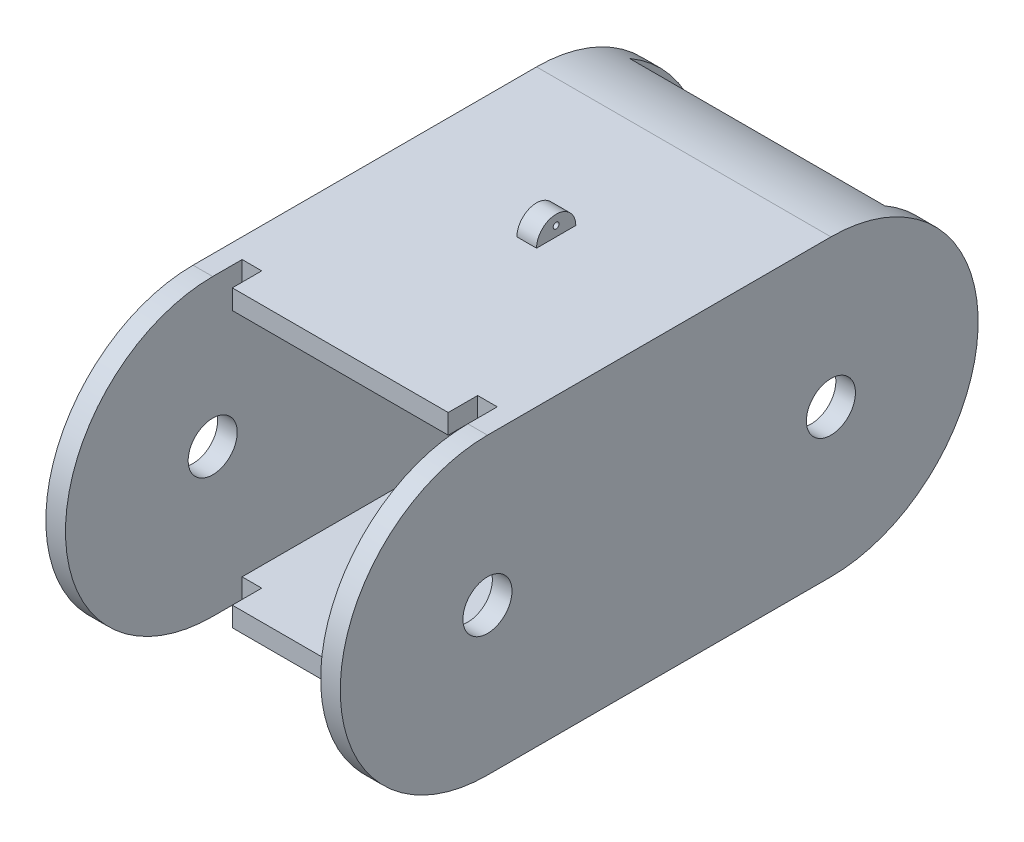
from build123d import *

# Parameters (mm, degrees)
SKETCH1_W           = 19.05
SKETCH1_H           = 41.275
BOSS_EXTRUDE1_DEPTH = 19.05
SKETCH2_W           = 16.51
SKETCH2_H           = 16.51
CUT_EXTRUDE1_DEPTH  = 50.8
SKETCH3_W           = 1.27
SKETCH3_H           = 2.54
BOSS_EXTRUDE2_DEPTH = 1.27
SKETCH4_R           = 0.1905
SKETCH4_R_2         = 1.5875
CUT_EXTRUDE2_DEPTH  = 19.05
CUT_EXTRUDE3_DEPTH  = 25.4


with BuildPart() as part:
    # Sketch1 → Boss-Extrude1 (new body)
    with BuildSketch(Plane(origin=(0, 0, 0), x_dir=(1, 0, 0), z_dir=(0, 1, 0))):
        with Locations((9.525, 20.6375)):
            Rectangle(SKETCH1_W, SKETCH1_H)
    extrude(amount=BOSS_EXTRUDE1_DEPTH)

    # Sketch2 → Cut-Extrude1 (cut)
    with BuildSketch(Plane.XY):
        with Locations((9.525, 9.525)):
            Rectangle(SKETCH2_W, SKETCH2_H)
    extrude(amount=-CUT_EXTRUDE1_DEPTH, mode=Mode.SUBTRACT)

    # Sketch3 → Boss-Extrude2 (add)
    with BuildSketch(Plane(origin=(0, 19.05, 0), x_dir=(1, 0, 0), z_dir=(0, 1, 0))):
        with Locations((9.525, 22.86)):
            Rectangle(SKETCH3_W, SKETCH3_H)
    extrude(amount=BOSS_EXTRUDE2_DEPTH)

    # Sketch4 → Cut-Extrude2 (cut)
    with BuildSketch(Plane(origin=(0, 0, 0), x_dir=(0, 0, -1), z_dir=(1, 0, 0))):
        with Locations((22.86, 19.685)):
            Circle(SKETCH4_R)
        with Locations((9.525, 9.525)):
            Circle(SKETCH4_R_2)
        with BuildLine():
            ThreePointArc((24.13, 19.05), (22.86, 22.337330126), (21.59, 19.05))
            add(Edge.make_bspline(
                [(24.13, 19.05), (24.13, 20.32), (22.86, 20.32), (21.59, 20.32), (21.59, 19.05)],
                knots=[3.141592654, 3.141592654, 3.141592654, 4.71238898, 4.71238898, 6.283185307, 6.283185307, 6.283185307], degree=2, weights=[1, 0.707106781, 1, 0.707106781, 1]))
        make_face()
        with BuildLine():
            ThreePointArc((9.525, 19.05), (0, 9.525), (9.525, 0))
            ThreePointArc((9.525, 0), (-6.861844225, 9.525), (9.525, 19.05))
        make_face()
    cut_extrude2 = extrude(amount=CUT_EXTRUDE2_DEPTH, mode=Mode.SUBTRACT)

    # Mirror1: Cut-Extrude2 across plane
    add(cut_extrude2.mirror(Plane.XY.offset(-20.6375)), mode=Mode.SUBTRACT)

    # Sketch7 → Cut-Extrude3 (cut)
    with BuildSketch(Plane(origin=(0, 19.05, 0), x_dir=(1, 0, 0), z_dir=(0, 1, 0))):
        Polygon((2.54, 9.525), (16.51, 9.525), (16.51, 11.43), (17.78, 11.43), (17.78, 0), (16.51, 0), (2.54, 0), (1.27, 0), (1.27, 11.43), (2.54, 11.43), align=None)
    extrude(amount=-CUT_EXTRUDE3_DEPTH, mode=Mode.SUBTRACT)


solid = part.part
